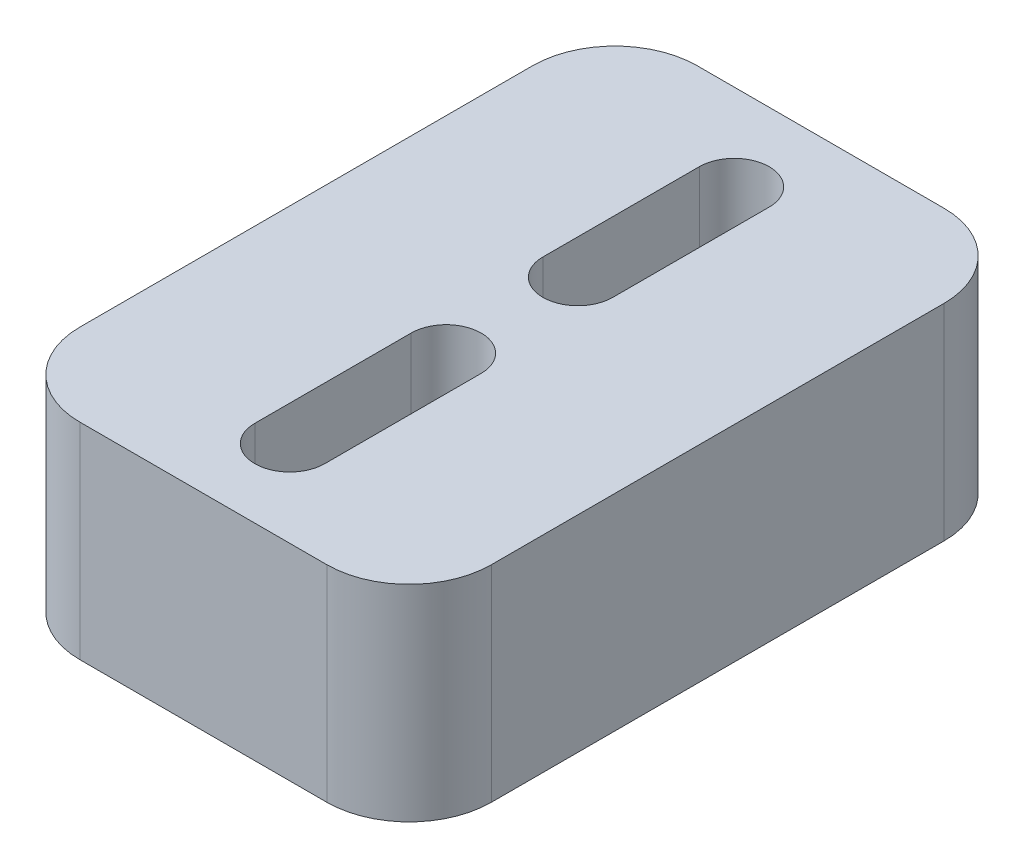
from build123d import *

# Parameters (mm, degrees)
SKETCH1_W           = 20
SKETCH1_H           = 30
BOSS_EXTRUDE1_DEPTH = 10
FILLET1_R           = 4


with BuildPart() as part:
    # Sketch1 → Boss-Extrude1 (new body)
    with BuildSketch(Plane(origin=(0, 0, 0), x_dir=(1, 0, 0), z_dir=(0, 1, 0))):
        Rectangle(SKETCH1_W, SKETCH1_H)
        with BuildLine():
            Line((1.7, 10.8), (1.7, 3.2))
            ThreePointArc((1.7, 3.2), (0, 1.5), (-1.7, 3.2))
            Line((-1.7, 3.2), (-1.7, 10.8))
            ThreePointArc((-1.7, 10.8), (0, 12.5), (1.7, 10.8))
        make_face(mode=Mode.SUBTRACT)
        with BuildLine():
            Line((1.7, -10.8), (1.7, -3.2))
            ThreePointArc((1.7, -3.2), (0, -1.5), (-1.7, -3.2))
            Line((-1.7, -3.2), (-1.7, -10.8))
            ThreePointArc((-1.7, -10.8), (0, -12.5), (1.7, -10.8))
        make_face(mode=Mode.SUBTRACT)
    extrude(amount=BOSS_EXTRUDE1_DEPTH)

    # Fillet1
    fillet1_edges = [part.edges().sort_by_distance(p)[0] for p in [
        (-10, 5, 15),
        (-10, 5, -15),
        (10, 5, -15),
        (10, 5, 15),
    ]]
    fillet(fillet1_edges, radius=FILLET1_R)


solid = part.part
